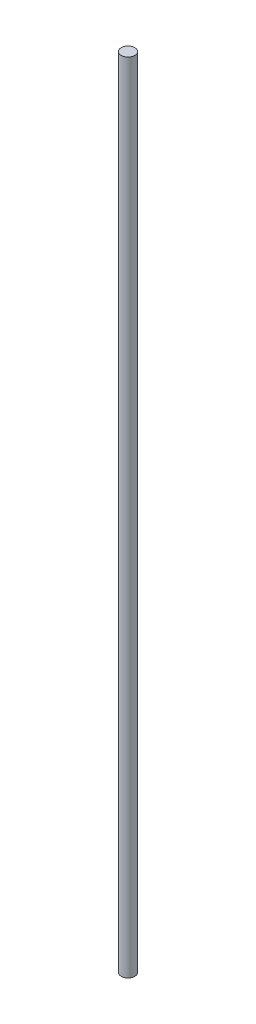
from build123d import *

# Parameters (mm, degrees)
SKETCH_2_W = 2.5
SKETCH_2_H = 294


with BuildPart() as part:
    # Эскиз2 → Повернуть1 (revolve)
    with BuildSketch(Plane.XY):
        with Locations((-1.25, 0)):
            Rectangle(SKETCH_2_W, SKETCH_2_H)
    revolve(axis=Axis((-2.5, 147, 0), (0, -1, 0)))


solid = part.part
